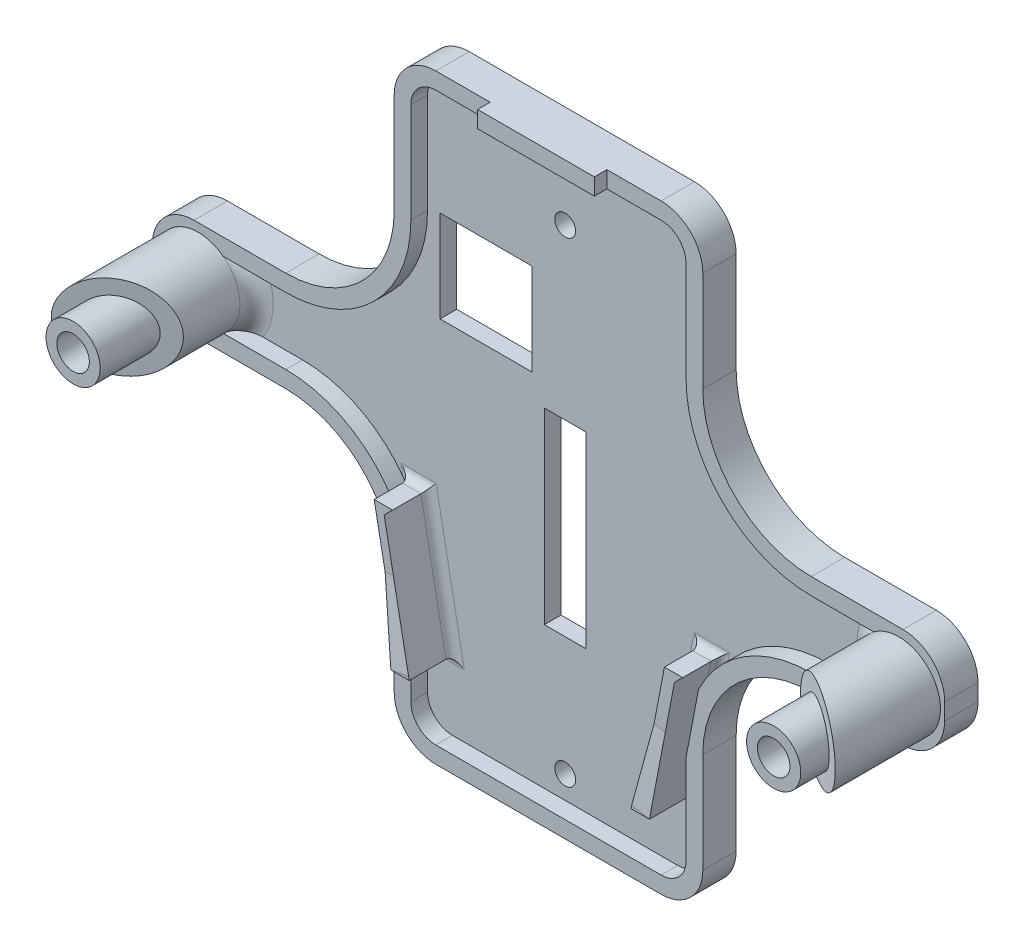
from build123d import *

# Parameters (mm, degrees)
BOSS_EXTRUDE1_DEPTH = 4
BOSS_EXTRUDE2_DEPTH = 1.5000000000000004
BOSS_EXTRUDE3_REACH = 61.735
SKETCH4_R           = 4.999999999999997
BOSS_EXTRUDE4_REACH = 62.923
SKETCH6_R           = 4.999999999999997
CUT_EXTRUDE1_START  = -1.9999999999999991
CUT_EXTRUDE1_DEPTH  = 1.9999999999999991
BOSS_EXTRUDE5_DEPTH = 3.4000000000000004
BOSS_EXTRUDE6_DEPTH = 3.4000000000000004
CUT_EXTRUDE2_DEPTH  = 62.875430452853614
CUT_EXTRUDE3_DEPTH  = 62.875430452853614
CUT_EXTRUDE4_DEPTH  = 1
CUT_EXTRUDE5_DEPTH  = 62.875430452853614
CUT_EXTRUDE6_DEPTH  = 1
CUT_EXTRUDE7_DEPTH  = 62.87543045285361
CUT_EXTRUDE8_DEPTH  = 62.36837559861016
CUT_EXTRUDE9_DEPTH  = 62.87543045285361
DRAFT1_START        = -20.010567338
DRAFT1_DEPTH        = 2.160299157
DRAFT2_ANGLE        = 83.64864717560759
HOLE1_D             = 2.5
HOLE2_D             = 2.5
HOLE3_D             = 3.9
HOLE3_CBORE_D       = 7.5
HOLE3_CBORE_DEPTH   = 9.5
HOLE4_D             = 3.9
HOLE4_CBORE_D       = 7.5
HOLE4_CBORE_DEPTH   = 9.5
FILLET1_R           = 1
FILLET2_R           = 1
FILLET3_R           = 2
FILLET4_R           = 2
FILLET5_R           = 2.9999999999999996
FILLET6_R           = 2.9999999999999996
FILLET7_R           = 2.9999999999999996
FILLET8_R           = 2.9999999999999996
FILLET9_R           = 5
FILLET10_R          = 5
FILLET11_R          = 5
FILLET12_R          = 5
FILLET13_R          = 5
FILLET14_R          = 5
FILLET15_R          = 5
FILLET16_R          = 5
FILLET17_R          = 13.000000000000002
FILLET18_R          = 13.000000000000002
FILLET19_R          = 15.000000000000004
FILLET20_R          = 15.000000000000004


# Read off the part's stored shape, not the designer's step: Draft1
with BuildPart() as part:
    # Sketch1 → Boss-Extrude1 (new body)
    with BuildSketch(Plane.XY.offset(-5.5)):
        Polygon((47.5, -36), (47.5, 36.00000000000001), (-47.5, 36.00000000000001), (-47.5, -36.00000000000002), align=None)
    extrude(amount=-BOSS_EXTRUDE1_DEPTH)

    # Sketch2 → Boss-Extrude2 (add)
    with BuildSketch(Plane.XY.offset(-5.5)):
        Polygon((-7, 36.00000000000001), (6.999999999999999, 36.00000000000001), (7, 34.00000000000001), (-7.000000000000001, 34), align=None)
    extrude(amount=BOSS_EXTRUDE2_DEPTH)

    # Boss-Extrude3: up to this plane
    boss_extrude3_end = Plane(origin=(8.867539620332717, 0, -15.16889706351879), z_dir=(-0.504678307080911, 0, 0.863307480774924))
    # Sketch4 → Boss-Extrude3 (add, up to the surface)
    with BuildSketch(Plane.XY.offset(-5.5), mode=Mode.PRIVATE) as boss_extrude3_sk1:
        with Locations(Location((42, -4.72e-15, 0), (0, 0, 180))):
            Circle(SKETCH4_R)
    boss_extrude3_tool1 = split(extrude(boss_extrude3_sk1.sketch, amount=BOSS_EXTRUDE3_REACH, mode=Mode.PRIVATE), bisect_by=boss_extrude3_end, keep=Keep.BOTH, mode=Mode.PRIVATE)
    add(boss_extrude3_tool1.solids().sort_by_distance((42, 0, -5.5))[0])

    # Boss-Extrude4: up to this plane
    boss_extrude4_end = Plane(origin=(-8.867539620332735, 0, -15.16889706351882), z_dir=(0.504678307080911, 0, 0.863307480774924))
    # Sketch6 → Boss-Extrude4 (add, up to the surface)
    with BuildSketch(Plane.XY.offset(-5.5), mode=Mode.PRIVATE) as boss_extrude4_sk1:
        with Locations((-42, -4.72e-15)):
            Circle(SKETCH6_R)
    boss_extrude4_tool1 = split(extrude(boss_extrude4_sk1.sketch, amount=BOSS_EXTRUDE4_REACH, mode=Mode.PRIVATE), bisect_by=boss_extrude4_end, keep=Keep.BOTH, mode=Mode.PRIVATE)
    add(boss_extrude4_tool1.solids().sort_by_distance((-42, 0, -5.5))[0])

    # Sketch7 → Cut-Extrude1 (cut)
    with BuildSketch(Plane.XY.offset(-5.5).offset(CUT_EXTRUDE1_START)):
        with BuildLine():
            Line((16.5, 34.00000000000002), (-16.499999999999996, 33.99999999999999))
            Line((-16.499999999999996, 33.99999999999999), (-16.500000000000007, 3.9999999999999964))
            Line((-16.500000000000007, 3.9999999999999964), (-39.00000000000001, 4))
            ThreePointArc((-39.00000000000001, 4), (-37, -2.8e-16), (-39, -4.000000000000003))
            Line((-39, -4.000000000000003), (-31.5, -4))
            ThreePointArc((-31.5, -4), (-23.519821394067325, -6.298946916990921), (-17.98577705522076, -12.491100077678077))
            Line((-17.98577705522076, -12.491100077678077), (-18.500000000000014, -9.800000000000002))
            Line((-18.500000000000014, -9.800000000000002), (-16.3006153135025, -9.8))
            Line((-16.3006153135025, -9.8), (-13.3, -25.500000000000004))
            Line((-13.3, -25.500000000000004), (-15.499999999999995, -25.5))
            Line((-15.499999999999995, -25.5), (-16.499999999999975, -20.266666666666797))
            Line((-16.499999999999975, -20.266666666666797), (-16.500000000000004, -34.00000000000001))
            Line((-16.500000000000004, -34.00000000000001), (16.500000000000007, -34))
            Line((16.500000000000007, -34), (16.5, -20.266666666666687))
            Line((16.5, -20.266666666666687), (15.5, -25.500000000000004))
            Line((15.5, -25.500000000000004), (13.3, -25.500000000000004))
            Line((13.3, -25.500000000000004), (16.3006153135025, -9.800000000000002))
            Line((16.3006153135025, -9.800000000000002), (18.500000000000014, -9.800000000000002))
            Line((18.500000000000014, -9.800000000000002), (17.985777055220748, -12.491100077678167))
            ThreePointArc((17.985777055220748, -12.491100077678167), (23.519821394067314, -6.29894691699096), (31.50000000000003, -3.9999999999999982))
            Line((31.50000000000003, -3.9999999999999982), (38.99999999999999, -4))
            ThreePointArc((38.99999999999999, -4), (37, 3.55e-15), (39.00000000000001, 4))
            Line((39.00000000000001, 4), (16.500000000000014, 3.9999999999999982))
            Line((16.500000000000014, 3.9999999999999982), (16.5, 34.00000000000002))
        make_face()
    extrude(amount=CUT_EXTRUDE1_DEPTH, mode=Mode.SUBTRACT)

    # Sketch8 → Boss-Extrude5 (add)
    with BuildSketch(Plane.XY.offset(-5.5)):
        Polygon((13.3, -25.500000000000004), (16.3006153135025, -9.8), (18.500000000000018, -9.799999999999999), (15.5, -25.500000000000004), align=None)
    extrude(amount=BOSS_EXTRUDE5_DEPTH)

    # Sketch9 → Boss-Extrude6 (add)
    with BuildSketch(Plane.XY.offset(-5.5)):
        Polygon((-16.300615313502515, -9.800000000000002), (-13.3, -25.500000000000004), (-15.5, -25.500000000000004), (-18.500000000000014, -9.800000000000002), align=None)
    extrude(amount=BOSS_EXTRUDE6_DEPTH)

    # Sketch10 → Cut-Extrude2 (cut, through all)
    with BuildSketch(Plane(origin=(0, 0, -9.5), x_dir=(-1, 0, 0), z_dir=(0, 0, -1))):
        Polygon((-47.5, 6.000000000000003), (-18.500000000000004, 6), (-18.5, 36.00000000000001), (-47.5, 36.00000000000001), align=None)
    extrude(amount=-CUT_EXTRUDE2_DEPTH, mode=Mode.SUBTRACT)

    # Sketch11 → Cut-Extrude3 (cut, through all)
    with BuildSketch(Plane(origin=(0, 0, -9.5), x_dir=(-1, 0, 0), z_dir=(0, 0, -1))):
        Polygon((47.5, 36.00000000000001), (18.5, 36.00000000000001), (18.499999999999996, 5.999999999999998), (47.49999999999999, 6.000000000000001), align=None)
    extrude(amount=-CUT_EXTRUDE3_DEPTH, mode=Mode.SUBTRACT)

    # Sketch12 → Cut-Extrude4 (cut)
    with BuildSketch(Plane.XY.offset(-2.099999999999998)):
        Polygon((-17.186190669421556, -16.675602163360537), (-15.064282448454913, -16.27014199374907), (-16.300615313502515, -9.800000000000002), (-18.500000000000014, -9.800000000000002), align=None)
    extrude(amount=-CUT_EXTRUDE4_DEPTH, mode=Mode.SUBTRACT)

    # Sketch13 → Cut-Extrude5 (cut, through all)
    with BuildSketch(Plane(origin=(0, 0, -9.5), x_dir=(-1, 0, 0), z_dir=(0, 0, -1))):
        with BuildLine():
            Line((47.499999999999986, -36.00000000000002), (47.5, -5.999999999999995))
            Line((47.5, -5.999999999999995), (31.5, -5.999999999999999))
            ThreePointArc((31.5, -5.999999999999999), (22.307611844574883, -9.80761184457488), (18.499999999999996, -19))
            Line((18.499999999999996, -19), (18.500000000000004, -36.00000000000001))
            Line((18.500000000000004, -36.00000000000001), (47.499999999999986, -36.00000000000002))
        make_face()
    extrude(amount=-CUT_EXTRUDE5_DEPTH, mode=Mode.SUBTRACT)

    # Sketch14 → Cut-Extrude6 (cut)
    with BuildSketch(Plane.XY.offset(-2.0999999999999996)):
        Polygon((16.30037067134624, -9.799953248297177), (15.064037806298458, -16.27009524204621), (17.185946027265093, -16.675555411657736), (18.499755357843753, -9.799953248297179), align=None)
    extrude(amount=-CUT_EXTRUDE6_DEPTH, mode=Mode.SUBTRACT)

    # Sketch15 → Cut-Extrude7 (cut, through all)
    with BuildSketch(Plane(origin=(0, 0, -9.5), x_dir=(-1, 0, 0), z_dir=(0, 0, -1))):
        with BuildLine():
            Line((-47.5, -36), (-18.500000000000004, -36.00000000000001))
            Line((-18.500000000000004, -36.00000000000001), (-18.5, -19))
            ThreePointArc((-18.5, -19), (-22.30761184457488, -9.807611844574883), (-31.5, -5.999999999999999))
            Line((-31.5, -5.999999999999999), (-47.5, -6))
            Line((-47.5, -6), (-47.5, -36))
        make_face()
    extrude(amount=-CUT_EXTRUDE7_DEPTH, mode=Mode.SUBTRACT)

    # Sketch16 → Cut-Extrude8 (cut, through all)
    with BuildSketch(Plane.XY.offset(-7.499999999999999)):
        Polygon((2.4999999999999987, 5.5), (-2.4999999999999996, 5.5), (-2.499999999999998, -17), (2.4999999999999996, -16.999999999999996), align=None)
    extrude(amount=-CUT_EXTRUDE8_DEPTH, mode=Mode.SUBTRACT)

    # Sketch17 → Cut-Extrude9 (cut, through all)
    with BuildSketch(Plane(origin=(0, 0, -9.5), x_dir=(-1, 0, 0), z_dir=(0, 0, -1))):
        Polygon((4, 8.5), (15, 8.5), (15.000000000000002, 19.5), (4.000000000000001, 19.500000000000004), align=None)
    extrude(amount=-CUT_EXTRUDE9_DEPTH, mode=Mode.SUBTRACT)

    # Draft1 outline → Draft1 (cut)
    with BuildSketch(Plane(origin=(0, 0, 0), x_dir=(-0.18768704709924006, 0.9822288798193461, 0), z_dir=(0.9822288798193463, 0.18768704709924006, 0)).offset(DRAFT1_START)):
        Polygon((-22.13768721, -2.1), (-13.153632656, -3.1), (-13.153632656, -2.1), align=None)
    extrude(amount=DRAFT1_DEPTH, mode=Mode.SUBTRACT)

    # Draft2
    draft2_faces = [part.faces().sort_by_distance(p)[0] for p in [
        (16.124991916781777, -16.472825326851975, -2.5999999999999996),
    ]]
    draft(draft2_faces, Plane.XY.offset(-3.0999999999999996), DRAFT2_ANGLE)

    # Sketch18 → Revolve1 (revolve)
    with BuildSketch(Plane(origin=(0, 0, 0), x_dir=(1, 0, 0), z_dir=(0, 1, 0)), mode=Mode.PRIVATE) as revolve1_sk:
        Polygon((-45.25, -9.5), (-42, -9.5), (-42, -2.299999999999974), (-45.25000000000001, -2.299999999999974), align=None)
    revolve(revolve1_sk.sketch.rotate(Axis((-42, 0, 9.5), (0, 0, -1)), 233.130102354), axis=Axis((-42, 0, 9.5), (0, 0, -1)))

    # Sketch19 → Revolve2 (revolve)
    with BuildSketch(Plane(origin=(0, 0, 0), x_dir=(1, 0, 0), z_dir=(0, 1, 0))):
        Polygon((38.75000000000001, -9.5), (42, -9.5), (42, -2.300000000000015), (38.75, -2.300000000000015), align=None)
    revolve(axis=Axis((42, 0, 9.5), (0, 0, -1)))

    # Hole1 (through all)
    with Locations(Plane.XY.offset(-7.499999999999999)):
        with Locations((0, -31.25)):
            Hole(HOLE1_D / 2)

    # Hole2 (through all)
    with Locations(Plane.XY.offset(-7.499999999999999)):
        with Locations((0, 25.75)):
            Hole(HOLE2_D / 2)

    # Hole3 (through all)
    with Locations(Plane(origin=(0, 0, -9.5), x_dir=(-1, 0, 0), z_dir=(0, 0, -1))):
        with Locations((42, 0)):
            CounterBoreHole(HOLE3_D / 2, HOLE3_CBORE_D / 2, HOLE3_CBORE_DEPTH)

    # Hole4 (through all)
    with Locations(Plane(origin=(0, 0, -9.5), x_dir=(-1, 0, 0), z_dir=(0, 0, -1))):
        with Locations((-42, 0)):
            CounterBoreHole(HOLE4_D / 2, HOLE4_CBORE_D / 2, HOLE4_CBORE_DEPTH)

    # Fillet1
    fillet1_edges = [part.edges().sort_by_distance(p)[0] for p in [
        (18.242888527610383, -11.145550038839085, -7.499999999999999),
        (17.40030765675126, -9.800000000000002, -7.499999999999999),
        (14.80030765675125, -17.650000000000002, -7.499999999999999),
        (14.4, -25.500000000000004, -7.499999999999999),
        (16, -22.883333333333347, -7.499999999999999),
    ]]
    fillet(fillet1_edges, radius=FILLET1_R)

    # Fillet2
    fillet2_edges = [part.edges().sort_by_distance(p)[0] for p in [
        (-15.999999999999986, -22.883333333333397, -7.499999999999999),
        (-14.399999999999999, -25.5, -7.499999999999999),
        (-14.80030765675125, -17.650000000000002, -7.499999999999999),
        (-17.40030765675126, -9.8, -7.499999999999999),
        (-18.242888527610386, -11.14555003883904, -7.499999999999999),
    ]]
    fillet(fillet2_edges, radius=FILLET2_R)

    # Fillet3
    fillet3_edges = [part.edges().sort_by_distance(p)[0] for p in [
        (-37, 3.3e-16, -7.499999999999999),
    ]]
    fillet(fillet3_edges, radius=FILLET3_R - 0.0001)  # a hair under: the kernel refuses the full size

    # Fillet4
    fillet4_edges = [part.edges().sort_by_distance(p)[0] for p in [
        (37, 3.11e-15, -7.499999999999999),
    ]]
    fillet(fillet4_edges, radius=FILLET4_R - 0.0001)  # a hair under: the kernel refuses the full size

    # Fillet5
    fillet5_edges = [part.edges().sort_by_distance(p)[0] for p in [
        (-16.499999999999996, 33.99999999999999, -6.5),
    ]]
    fillet(fillet5_edges, radius=FILLET5_R)

    # Fillet6
    fillet6_edges = [part.edges().sort_by_distance(p)[0] for p in [
        (16.5, 34.00000000000002, -6.5),
    ]]
    fillet(fillet6_edges, radius=FILLET6_R)

    # Fillet7
    fillet7_edges = [part.edges().sort_by_distance(p)[0] for p in [
        (-16.500000000000004, -34.00000000000001, -6.5),
    ]]
    fillet(fillet7_edges, radius=FILLET7_R)

    # Fillet8
    fillet8_edges = [part.edges().sort_by_distance(p)[0] for p in [
        (16.500000000000007, -34, -6.5),
    ]]
    fillet(fillet8_edges, radius=FILLET8_R)

    # Fillet9
    fillet9_edges = [part.edges().sort_by_distance(p)[0] for p in [
        (-18.5, 36.00000000000001, -7.5),
    ]]
    fillet(fillet9_edges, radius=FILLET9_R)

    # Fillet10
    fillet10_edges = [part.edges().sort_by_distance(p)[0] for p in [
        (-47.5, -5.999999999999995, -7.5),
    ]]
    fillet(fillet10_edges, radius=FILLET10_R)

    # Fillet11
    fillet11_edges = [part.edges().sort_by_distance(p)[0] for p in [
        (-47.49999999999999, 6.000000000000001, -7.5),
    ]]
    fillet(fillet11_edges, radius=FILLET11_R)

    # Fillet12
    fillet12_edges = [part.edges().sort_by_distance(p)[0] for p in [
        (18.500000000000004, -36.00000000000001, -7.5),
    ]]
    fillet(fillet12_edges, radius=FILLET12_R)

    # Fillet13
    fillet13_edges = [part.edges().sort_by_distance(p)[0] for p in [
        (47.5, 6.000000000000003, -7.5),
    ]]
    fillet(fillet13_edges, radius=FILLET13_R)

    # Fillet14
    fillet14_edges = [part.edges().sort_by_distance(p)[0] for p in [
        (18.5, 36.00000000000001, -7.5),
    ]]
    fillet(fillet14_edges, radius=FILLET14_R)

    # Fillet15
    fillet15_edges = [part.edges().sort_by_distance(p)[0] for p in [
        (-18.500000000000004, -36.00000000000001, -7.5),
    ]]
    fillet(fillet15_edges, radius=FILLET15_R)

    # Fillet16
    fillet16_edges = [part.edges().sort_by_distance(p)[0] for p in [
        (47.5, -6, -7.5),
    ]]
    fillet(fillet16_edges, radius=FILLET16_R)

    # Fillet17
    fillet17_edges = [part.edges().sort_by_distance(p)[0] for p in [
        (-18.499999999999996, 5.999999999999998, -7.5),
    ]]
    fillet(fillet17_edges, radius=FILLET17_R)

    # Fillet18
    fillet18_edges = [part.edges().sort_by_distance(p)[0] for p in [
        (18.500000000000004, 6, -7.5),
    ]]
    fillet(fillet18_edges, radius=FILLET18_R)

    # Fillet19
    fillet19_edges = [part.edges().sort_by_distance(p)[0] for p in [
        (-16.500000000000007, 3.9999999999999964, -6.5),
    ]]
    fillet(fillet19_edges, radius=FILLET19_R)

    # Fillet20
    fillet20_edges = [part.edges().sort_by_distance(p)[0] for p in [
        (16.500000000000014, 3.9999999999999982, -6.5),
    ]]
    fillet(fillet20_edges, radius=FILLET20_R)


solid = part.part
